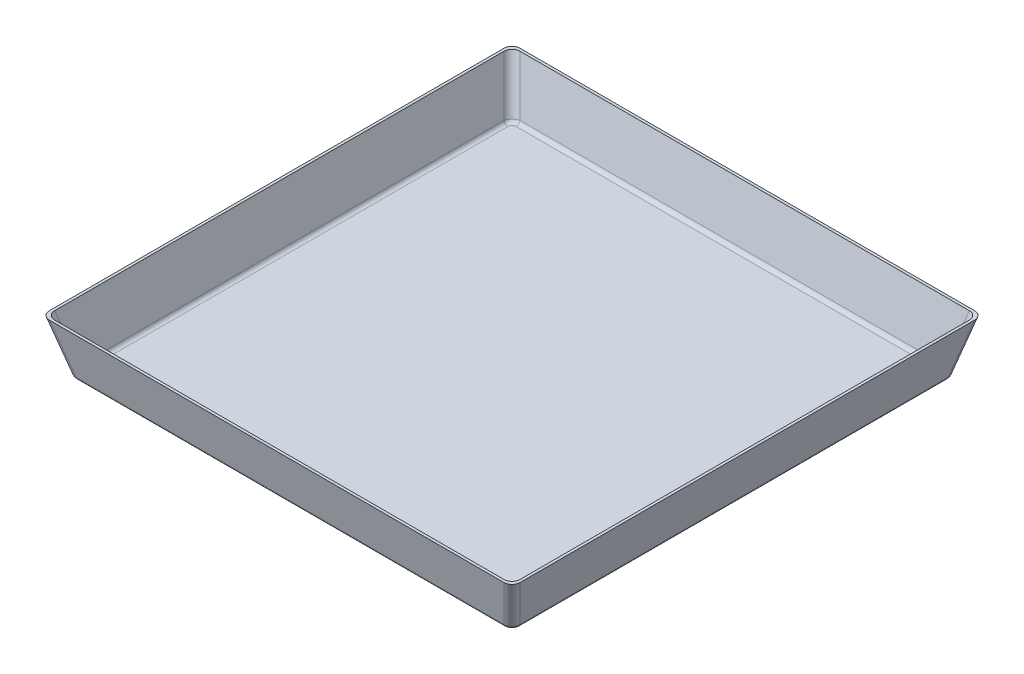
from build123d import *

# Parameters (mm, degrees)
SKETCH1_W           = 266.7
SKETCH1_H           = 266.7
BOSS_EXTRUDE1_DEPTH = 31.75
BOSS_EXTRUDE1_DRAFT = -15
SKETCH5_W           = 280.53977372
SKETCH5_H           = 280.53977372
CUT_EXTRUDE3_DEPTH  = 30.353
CUT_EXTRUDE3_DRAFT  = -15
FILLET3_R           = 5.08
FILLET4_R           = 2.54
FILLET1_R           = 5.08
FILLET2_R           = 2.54


with BuildPart() as part:
    # Sketch1 → Boss-Extrude1 (with draft: the straight prism first)
    with BuildSketch(Plane(origin=(0, 0, 0), x_dir=(1, 0, 0), z_dir=(0, 1, 0))):
        with Locations((133.35, 133.35)):
            Rectangle(SKETCH1_W, SKETCH1_H)
    extrude(amount=BOSS_EXTRUDE1_DEPTH)
    # Boss-Extrude1: the draft: its side faces are tilted about the plane it starts from
    boss_extrude1_sides = [part.faces().sort_by_distance(p)[0] for p in [
        (133.35, 15.875, 0),
        (266.7, 15.875, -133.35),
        (133.35, 15.875, -266.7),
        (0, 15.875, -133.35),
    ]]
    draft(boss_extrude1_sides, Plane(origin=(0, 0, 0), x_dir=(1, 0, 0), z_dir=(0, 1, 0)), BOSS_EXTRUDE1_DRAFT)


with BuildPart() as cut_extrude3_tool:
    # Sketch5 → Cut-Extrude3 (with draft: the straight prism first)
    with BuildSketch(Plane(origin=(0, 31.75, 0), x_dir=(1, 0, 0), z_dir=(0, 1, 0))):
        with Locations((133.35, 133.35)):
            Rectangle(SKETCH5_W, SKETCH5_H)
    extrude(amount=-CUT_EXTRUDE3_DEPTH)
    # Cut-Extrude3: the draft: its side faces are tilted about the plane it starts from
    cut_extrude3_sides = [cut_extrude3_tool.faces().sort_by_distance(p)[0] for p in [
        (-6.91988686, 16.5735, -133.35),
        (133.35, 16.5735, 6.91988686),
        (273.61988686, 16.5735, -133.35),
        (133.35, 16.5735, -273.61988686),
    ]]
    draft(cut_extrude3_sides, Plane(origin=(0, 31.75, 0), x_dir=(1, 0, 0), z_dir=(0, 1, 0)), CUT_EXTRUDE3_DRAFT)


with BuildPart() as part_1:
    add(part.part)

    # Cut-Extrude3: cut by cut_extrude3_tool
    add(cut_extrude3_tool.part, mode=Mode.SUBTRACT)

    # Fillet3
    fillet3_edges = [part_1.edges().sort_by_distance(p)[0] for p in [
        (269.553355941, 16.5735, -269.553355941),
        (269.553355941, 16.5735, 2.853355941),
        (-2.853355941, 16.5735, -269.553355941),
        (-2.853355941, 16.5735, 2.853355941),
    ]]
    fillet(fillet3_edges, radius=FILLET3_R)

    # Fillet4
    fillet4_edges = [part_1.edges().sort_by_distance(p)[0] for p in [
        (2.631021943, 1.397, -264.068978057),
        (133.35, 1.397, -265.486825022),
        (264.068978057, 1.397, -264.068978057),
        (265.486825022, 1.397, -133.35),
        (264.068978057, 1.397, -2.631021943),
        (133.35, 1.397, -1.213174978),
        (2.631021943, 1.397, -2.631021943),
        (1.213174978, 1.397, -133.35),
    ]]
    fillet(fillet4_edges, radius=FILLET4_R)

    # Fillet1
    fillet1_edges = [part_1.edges().sort_by_distance(p)[0] for p in [
        (-4.25369343, 15.875, -270.95369343),
        (270.95369343, 15.875, -270.95369343),
        (270.95369343, 15.875, 4.25369343),
        (-4.25369343, 15.875, 4.25369343),
    ]]
    fillet(fillet1_edges, radius=FILLET1_R)

    # Fillet2
    fillet2_edges = [part_1.edges().sort_by_distance(p)[0] for p in [
        (1.417846965, 0, -265.282153035),
        (133.35, 0, -266.7),
        (265.282153035, 0, -265.282153035),
        (266.7, 0, -133.35),
        (265.282153035, 0, -1.417846965),
        (133.35, 0, 0),
        (1.417846965, 0, -1.417846965),
        (0, 0, -133.35),
    ]]
    fillet(fillet2_edges, radius=FILLET2_R)


solid = part_1.part
